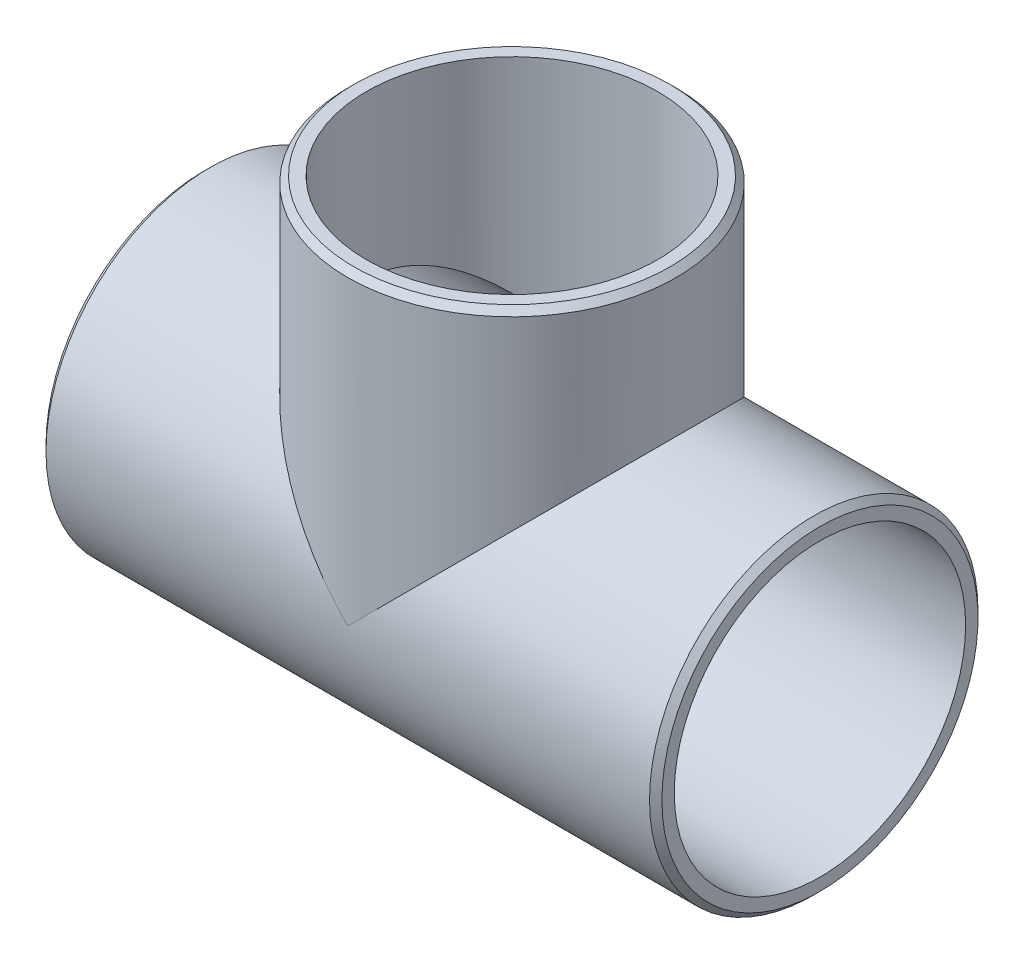
from build123d import *

# Parameters (mm, degrees)
RUNROUTE_R           = 50.8
RUNEXTRUDE_DEPTH     = 95.25
OUTLETROUTE_R        = 50.8
OUTLETEXTRUDE_DEPTH  = 95.25
TEESHELL_START       = -95.25
TEESHELL_OUTLINE_R   = 45.0596
TEESHELL_DEPTH       = 190.5
TEESHELL_START_2     = -1e-07
TEESHELL_2_OUTLINE_R = 45.0596
TEESHELL_2_DEPTH     = 95.2500001
TEECHAMFER_SIZE      = 1.913466667


with BuildPart() as part:
    # RunRoute → RunExtrude (new body)
    with BuildSketch(Plane(origin=(0, 0, 0), x_dir=(0, 0, -1), z_dir=(1, 0, 0))):
        Circle(RUNROUTE_R)
    runextrude = extrude(amount=RUNEXTRUDE_DEPTH)

    # RunExtrudeMirror: RunExtrude across plane
    add(runextrude.mirror(Plane(origin=(0, 0, 0), x_dir=(0, 0, 1), z_dir=(1, 0, 0))))

    # OutletRoute → OutletExtrude (add)
    with BuildSketch(Plane(origin=(0, 0, 0), x_dir=(1, 0, 0), z_dir=(0, 1, 0))):
        with Locations(Location((0, 0, 0), (0, 0, 270))):
            Circle(OUTLETROUTE_R)
    extrude(amount=OUTLETEXTRUDE_DEPTH)

    # TeeShell: read off the stored shape, not the designer's step
    # TeeShell outline → TeeShell (cut)
    with BuildSketch(Plane.YZ.offset(TEESHELL_START)):
        Circle(TEESHELL_OUTLINE_R)
    extrude(amount=TEESHELL_DEPTH, mode=Mode.SUBTRACT)

    # TeeShell 2 outline → TeeShell 2 (cut)
    with BuildSketch(Plane(origin=(0, 0, 0), x_dir=(1, 0, 0), z_dir=(0, 1, 0)).offset(TEESHELL_START_2)):
        Circle(TEESHELL_2_OUTLINE_R)
    extrude(amount=TEESHELL_2_DEPTH, mode=Mode.SUBTRACT)

    # TeeChamfer
    # the kernel refuses this chamfer: 1.913466667 mm, written as the material it takes off along each edge
    with BuildSketch(Plane(origin=(95.25, 0, 0), x_dir=(0, 0, -1), z_dir=(0, -1, 0))) as teechamfer_piece_1:
        Polygon((50.8, -TEECHAMFER_SIZE), (50.8 - TEECHAMFER_SIZE, 0), (50.8, 0), align=None)
    revolve(axis=Axis((95.25, 0, 0), (1, 0, 0)), mode=Mode.SUBTRACT)
    with BuildSketch(Plane(origin=(-95.25, 0, 0), x_dir=(0, 0, -1), z_dir=(0, -1, 0))) as teechamfer_piece_2:
        Polygon((50.8, TEECHAMFER_SIZE), (50.8 - TEECHAMFER_SIZE, 0), (50.8, 0), align=None)
    revolve(axis=Axis((-95.25, 0, 0), (1, 0, 0)), mode=Mode.SUBTRACT)
    with BuildSketch(Plane(origin=(0, 95.25, 0), x_dir=(0, 0, 1), z_dir=(-1, 0, 0))) as teechamfer_piece_3:
        Polygon((50.8, -TEECHAMFER_SIZE), (50.8 - TEECHAMFER_SIZE, 0), (50.8, 0), align=None)
    revolve(axis=Axis((0, 95.25, 0), (0, 1, 0)), mode=Mode.SUBTRACT)


solid = part.part
